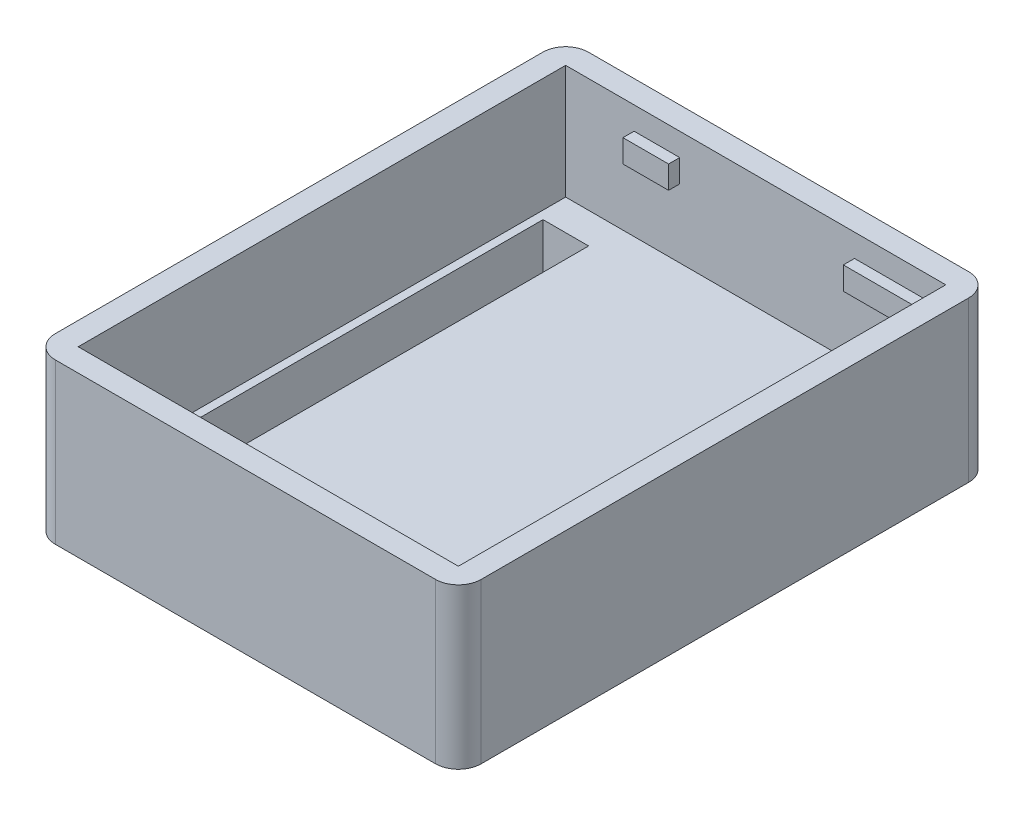
from build123d import *

# Parameters (mm, degrees)
BOSS_EXTRU_1_DEPTH      = 7
ESQUISSE2_W             = 16.66012
ESQUISSE2_H             = 21.36185
ENL_V_MAT_EXTRU_1_DEPTH = 5
ESQUISSE5_W             = 2
ESQUISSE5_H             = 19.76
ENL_V_MAT_EXTRU_3_DEPTH = 31.314618814
ESQUISSE6_W             = 3
ESQUISSE6_H             = 1
BOSS_EXTRU_2_DEPTH      = 0.48904
ESQUISSE7_W             = 3
ESQUISSE7_H             = 1
BOSS_EXTRU_3_DEPTH      = 0.48904
ESQUISSE8_W             = 3
ESQUISSE8_H             = 1
BOSS_EXTRU_4_DEPTH      = 0.48904
ESQUISSE9_W             = 3
ESQUISSE9_H             = 1
BOSS_EXTRU_5_DEPTH      = 0.48904
ESQUISSE10_W            = 2
ESQUISSE10_H            = 1
BOSS_EXTRU_6_DEPTH      = 0.48904
ESQUISSE11_W            = 2
ESQUISSE11_H            = 1
BOSS_EXTRU_7_DEPTH      = 0.48904


with BuildPart() as part:
    # Esquisse1 → Boss.-Extru.1 (new body)
    with BuildSketch(Plane(origin=(0, 0, 0), x_dir=(1, 0, 0), z_dir=(0, 1, 0))):
        with BuildLine():
            Line((1, 0), (17.66012, 0))
            ThreePointArc((17.66012, 0), (18.367226781, 0.292893219), (18.66012, 1))
            Line((18.66012, 1), (18.66012, 22.36185))
            ThreePointArc((18.66012, 22.36185), (18.367226781, 23.068956781), (17.66012, 23.36185))
            Line((17.66012, 23.36185), (1, 23.36185))
            ThreePointArc((1, 23.36185), (0.292893219, 23.068956781), (0, 22.36185))
            Line((0, 22.36185), (0, 1))
            ThreePointArc((0, 1), (0.292893219, 0.292893219), (1, 0))
        make_face()
    extrude(amount=BOSS_EXTRU_1_DEPTH)

    # Esquisse2 → Enlèv. mat.-Extru.1 (cut)
    with BuildSketch(Plane(origin=(0, 7, 0), x_dir=(1, 0, 0), z_dir=(0, 1, 0))):
        with Locations((9.33006, 11.680925)):
            Rectangle(ESQUISSE2_W, ESQUISSE2_H)
    extrude(amount=-ENL_V_MAT_EXTRU_1_DEPTH, mode=Mode.SUBTRACT)

    # Esquisse5 → Enlèv. mat.-Extru.3 (cut, through all)
    with BuildSketch(Plane(origin=(0, 2, 0), x_dir=(1, 0, 0), z_dir=(0, 1, 0))):
        with Locations((2.36, 11.13)):
            Rectangle(ESQUISSE5_W, ESQUISSE5_H)
    extrude(amount=-ENL_V_MAT_EXTRU_3_DEPTH, mode=Mode.SUBTRACT)

    # Esquisse6 → Boss.-Extru.2 (add)
    with BuildSketch(Plane.XY.offset(-22.36185)):
        with Locations((15.16012, 5.5)):
            Rectangle(ESQUISSE6_W, ESQUISSE6_H)
    extrude(amount=BOSS_EXTRU_2_DEPTH)

    # Esquisse7 → Boss.-Extru.3 (add)
    with BuildSketch(Plane.ZY.offset(-17.66012)):
        with Locations((-19.86185, 5.5)):
            Rectangle(ESQUISSE7_W, ESQUISSE7_H)
    extrude(amount=BOSS_EXTRU_3_DEPTH)

    # Esquisse8 → Boss.-Extru.4 (add)
    with BuildSketch(Plane(origin=(0, 0, -1), x_dir=(-1, 0, 0), z_dir=(0, 0, -1))):
        with Locations((-15.16012, 5.5)):
            Rectangle(ESQUISSE8_W, ESQUISSE8_H)
    extrude(amount=BOSS_EXTRU_4_DEPTH)

    # Esquisse9 → Boss.-Extru.5 (add)
    with BuildSketch(Plane.ZY.offset(-17.66012)):
        with Locations((-3.5, 5.5)):
            Rectangle(ESQUISSE9_W, ESQUISSE9_H)
    extrude(amount=BOSS_EXTRU_5_DEPTH)

    # Esquisse10 → Boss.-Extru.6 (add)
    with BuildSketch(Plane.XY.offset(-22.36185)):
        with Locations((5, 5.5)):
            Rectangle(ESQUISSE10_W, ESQUISSE10_H)
    extrude(amount=BOSS_EXTRU_6_DEPTH)

    # Esquisse11 → Boss.-Extru.7 (add)
    with BuildSketch(Plane(origin=(0, 0, -1), x_dir=(-1, 0, 0), z_dir=(0, 0, -1))):
        with Locations((-5, 5.5)):
            Rectangle(ESQUISSE11_W, ESQUISSE11_H)
    extrude(amount=BOSS_EXTRU_7_DEPTH)


solid = part.part
